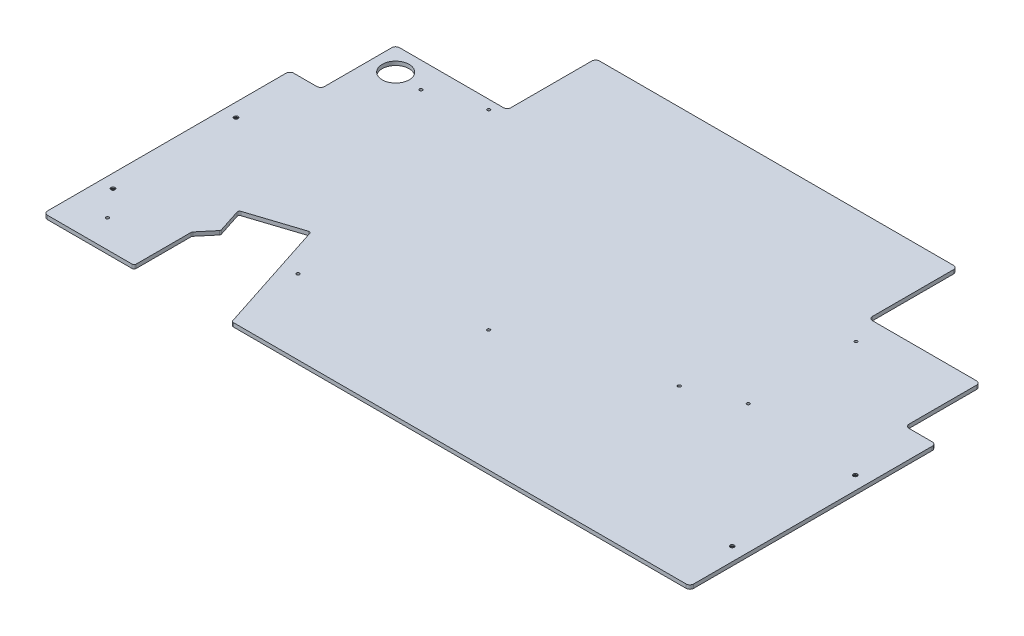
from build123d import *

# Parameters (mm, degrees)
SKETCH1_R                                     = 3.3734375
BOSS_EXTRUDE1_DEPTH                           = 6.35
SKETCH3_R                                     = 2.45745
SKETCH3_R_2                                   = 22.225
CUT_EXTRUDE2_DEPTH                            = 1264.111411604
CUT_EXTRUDE1_DEPTH                            = 1264.111411604
CSK_FOR_1_4_FLAT_HEAD_MACHINE_SCREW1_AT_COUNT = 2
CSK_FOR_1_4_FLAT_HEAD_MACHINE_SCREW1_AT_PITCH = 1022.35
CSK_FOR_1_4_FLAT_HEAD_MACHINE_SCREW1_2_COUNT  = 2
CSK_FOR_1_4_FLAT_HEAD_MACHINE_SCREW1_2_PITCH  = 203.2
CSK_FOR_1_4_FLAT_HEAD_MACHINE_SCREW1_3_COUNT  = 2
CSK_FOR_1_4_FLAT_HEAD_MACHINE_SCREW1_3_PITCH  = 1042.348196382
FILLET1_R                                     = 6.35
FILLET3_R                                     = 3.175


with BuildPart() as part:
    # Sketch1 → Boss-Extrude1 (new body)
    with BuildSketch(Plane(origin=(0, 0, 0), x_dir=(1, 0, 0), z_dir=(0, 1, 0))):
        Polygon((1016, 406.4), (1066.8, 406.4), (1066.8, 0), (0, 0), (0, 406.4), (50.8, 406.4), (50.8, 530.225), (234.95, 530.225), (234.95, 676.275), (831.85, 676.275), (831.85, 530.225), (1016, 530.225), align=None)
        with Locations((22.225, 92.075)):
            Circle(SKETCH1_R, mode=Mode.SUBTRACT)
        with Locations((1044.575, 92.075)):
            Circle(SKETCH1_R, mode=Mode.SUBTRACT)
        with Locations((22.225, 295.275)):
            Circle(SKETCH1_R, mode=Mode.SUBTRACT)
        with Locations((1044.575, 295.275)):
            Circle(SKETCH1_R, mode=Mode.SUBTRACT)
    extrude(amount=BOSS_EXTRUDE1_DEPTH)

    # Sketch3 → Cut-Extrude2 (cut, through all)
    with BuildSketch(Plane(origin=(0, 6.35, 0), x_dir=(1, 0, 0), z_dir=(0, 1, 0))):
        with Locations((134.9375, 487.748914195)):
            Circle(SKETCH3_R)
        with Locations((219.486424299, 515.220524995)):
            Circle(SKETCH3_R)
        with Locations((59.31154, 45.87748)):
            Circle(SKETCH3_R)
        with Locations((296.845703608, 123.057008284)):
            Circle(SKETCH3_R)
        with Locations((534.379867216, 200.236536569)):
            Circle(SKETCH3_R)
        with Locations((771.914030824, 277.416064853)):
            Circle(SKETCH3_R)
        with Locations((854.075, 309.0545)):
            Circle(SKETCH3_R)
        with Locations((854.075, 486.8545)):
            Circle(SKETCH3_R)
        with Locations((88.9, 492.125)):
            Circle(SKETCH3_R_2)
    extrude(amount=-CUT_EXTRUDE2_DEPTH, mode=Mode.SUBTRACT)

    # Sketch2 → Cut-Extrude1 (cut, through all)
    with BuildSketch(Plane(origin=(0, 6.35, 0), x_dir=(1, 0, 0), z_dir=(0, 1, 0))):
        Polygon((310.578822168, 0), (149.225, 0), (149.225, 95.25), (171.033618902, 121.240499926), (157.061866823, 164.241131286), (247.65, 193.675), align=None)
    extrude(amount=-CUT_EXTRUDE1_DEPTH, mode=Mode.SUBTRACT)

    # Sketch5 → CSK for 1/4 Flat Head Machine Screw1 (revolve, cut)
    with BuildSketch(Plane(origin=(22.225, 0, -92.075), x_dir=(0, 0, -1), z_dir=(1, 0, 0))):
        Polygon((0, 0), (0, 6.35), (3.3782, 6.35), (3.3782, 4.536932584), (6.4389, 1.016), (6.4389, 0), align=None)
    csk_for_1_4_flat_head_machine_screw1 = revolve(axis=Axis((22.225, -6.35, -92.075), (0, 1, 0)), mode=Mode.SUBTRACT)

    # CSK for 1/4 Flat Head Machine Screw1 at: CSK for 1/4 Flat Head Machine Screw1 ×2
    with Locations(*[(i * CSK_FOR_1_4_FLAT_HEAD_MACHINE_SCREW1_AT_PITCH, 0, 0) for i in range(1, CSK_FOR_1_4_FLAT_HEAD_MACHINE_SCREW1_AT_COUNT)]):
        add(csk_for_1_4_flat_head_machine_screw1, mode=Mode.SUBTRACT)

    # CSK for 1_4 Flat Head Machine Screw1 2: CSK for 1/4 Flat Head Machine Screw1 ×2
    with Locations(*[(0, 0, -i * CSK_FOR_1_4_FLAT_HEAD_MACHINE_SCREW1_2_PITCH) for i in range(1, CSK_FOR_1_4_FLAT_HEAD_MACHINE_SCREW1_2_COUNT)]):
        add(csk_for_1_4_flat_head_machine_screw1, mode=Mode.SUBTRACT)

    # CSK for 1_4 Flat Head Machine Screw1 3: CSK for 1/4 Flat Head Machine Screw1 ×2
    with Locations(*[Vector(0.9808142840837317, 0, -0.19494445397937524) * (i * CSK_FOR_1_4_FLAT_HEAD_MACHINE_SCREW1_3_PITCH) for i in range(1, CSK_FOR_1_4_FLAT_HEAD_MACHINE_SCREW1_3_COUNT)]):
        add(csk_for_1_4_flat_head_machine_screw1, mode=Mode.SUBTRACT)

    # Fillet1
    fillet1_edges = [part.edges().sort_by_distance(p)[0] for p in [
        (50.8, 3.175, -406.4),
        (0, 3.175, -406.4),
        (50.8, 3.175, -530.225),
        (234.95, 3.175, -530.225),
        (234.95, 3.175, -676.275),
        (0, 3.175, 0),
        (1066.8, 3.175, 0),
        (1066.8, 3.175, -406.4),
        (1016, 3.175, -406.4),
        (1016, 3.175, -530.225),
        (831.85, 3.175, -530.225),
        (831.85, 3.175, -676.275),
    ]]
    fillet(fillet1_edges, radius=FILLET1_R)

    # Fillet3
    fillet3_edges = [part.edges().sort_by_distance(p)[0] for p in [
        (310.578822168, 3.175, 0),
        (247.65, 3.175, -193.675),
        (157.061866823, 3.175, -164.241131286),
        (171.033618902, 3.175, -121.240499926),
        (149.225, 3.175, -95.25),
        (149.225, 3.175, 0),
    ]]
    fillet(fillet3_edges, radius=FILLET3_R)


solid = part.part
